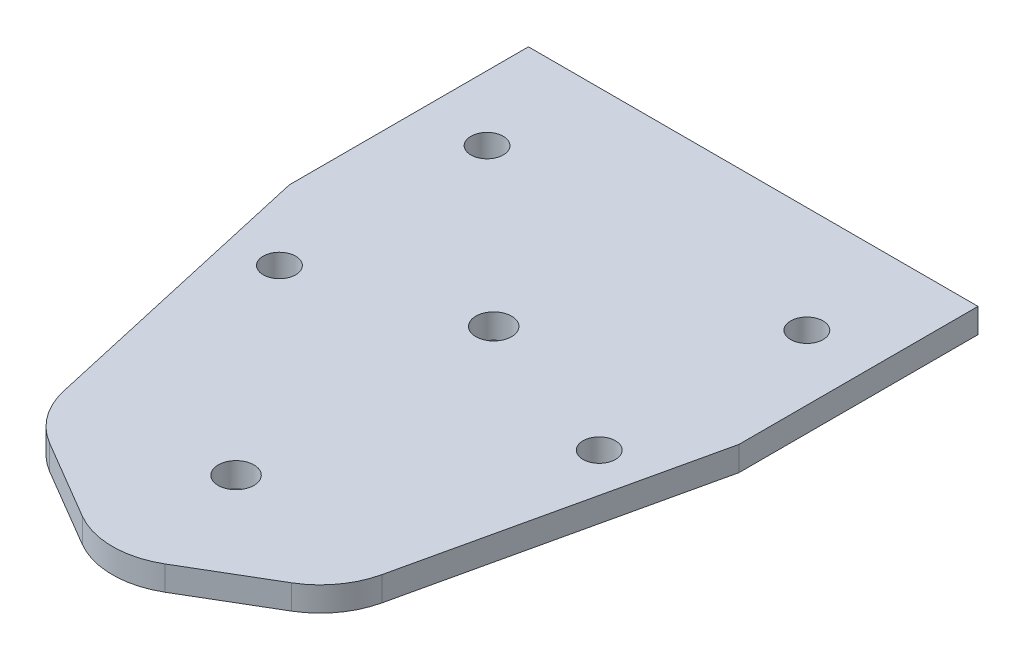
from build123d import *

# Parameters (mm, degrees)
SKETCH1_W           = 55
SKETCH1_H           = 80
BOSS_EXTRUDE1_DEPTH = 3
SKETCH2_R           = 2.185
SKETCH2_R_2         = 1.984375
CUT_EXTRUDE1_DEPTH  = 49.633835958
CUT_EXTRUDE2_DEPTH  = 49.633835958
FILLET1_R           = 10


with BuildPart() as part:
    # Sketch1 → Boss-Extrude1 (new body)
    with BuildSketch(Plane(origin=(0, 0, 0), x_dir=(1, 0, 0), z_dir=(0, 1, 0))):
        Rectangle(SKETCH1_W, SKETCH1_H)
    extrude(amount=BOSS_EXTRUDE1_DEPTH)

    # Sketch2 → Cut-Extrude1 (cut, through all)
    with BuildSketch(Plane(origin=(0, 3, 0), x_dir=(1, 0, 0), z_dir=(0, 1, 0))):
        with Locations((0, 8.25)):
            Circle(SKETCH2_R)
        with Locations((0, -23.271)):
            Circle(SKETCH2_R)
        with Locations((-19.5625, 27)):
            Circle(SKETCH2_R_2)
        with Locations((-19.5625, 1.6)):
            Circle(SKETCH2_R_2)
        with Locations((19.5625, 27)):
            Circle(SKETCH2_R_2)
        with Locations((19.5625, 1.6)):
            Circle(SKETCH2_R_2)
    extrude(amount=-CUT_EXTRUDE1_DEPTH, mode=Mode.SUBTRACT)

    # Sketch3 → Cut-Extrude2 (cut, through all)
    with BuildSketch(Plane(origin=(0, 3, 0), x_dir=(1, 0, 0), z_dir=(0, 1, 0))):
        Polygon((18.510308796, -29.09449619), (0, -40), (27.5, -40), (27.5, 10.752872816), align=None)
    cut_extrude2 = extrude(amount=-CUT_EXTRUDE2_DEPTH, mode=Mode.SUBTRACT)

    # Mirror1: Cut-Extrude2 across plane
    add(cut_extrude2.mirror(Plane(origin=(0, 0, 0), x_dir=(0, 0, 1), z_dir=(1, 0, 0))), mode=Mode.SUBTRACT)

    # Fillet1
    fillet1_edges = [part.edges().sort_by_distance(p)[0] for p in [
        (18.510308796, 1.5, 29.09449619),
        (0, 1.5, 40),
        (-18.510308796, 1.5, 29.09449619),
    ]]
    fillet(fillet1_edges, radius=FILLET1_R)


solid = part.part
